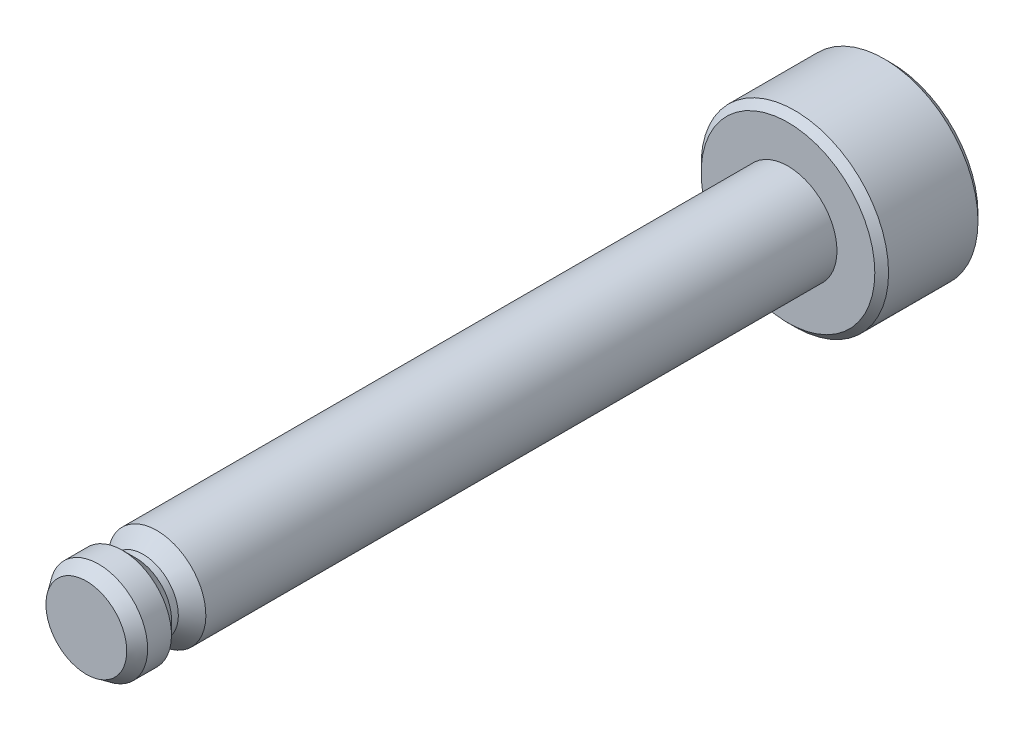
from build123d import *

# Parameters (mm, degrees)
SKETCH2_R      = 1.425
SHAFT_DEPTH    = 20.4
SKETCH5_R      = 2.725
HEAD_DEPTH     = 3
CHAMFER1_SIZE  = 0.25
CHAMFER1_SIZE2 = 0.357037002
DEBURS_SIZE    = 0.2


with BuildPart() as part:
    # Sketch2 → Shaft (new body)
    with BuildSketch(Plane.XY):
        Circle(SKETCH2_R)
    extrude(amount=SHAFT_DEPTH)

    # Sketch5 → Head (add)
    with BuildSketch(Plane.XY):
        Circle(SKETCH5_R)
    extrude(amount=-HEAD_DEPTH)

    # Sketch4 → e-Clip Notch Short (revolve, cut)
    with BuildSketch(Plane(origin=(0, 0, 0), x_dir=(0, 0, -1), z_dir=(1, 0, 0))):
        Polygon((-19.35, 1.425), (-18.35, 1.425), (-18.75, 1.025), (-18.95, 1.025), align=None)
    revolve(axis=Axis((0, 0, 0), (0, 0, 1)), mode=Mode.SUBTRACT)

    # Chamfer1
    chamfer1_edges = [part.edges().sort_by_distance(p)[0] for p in [
        (-1.425, 0, 20.4),
    ]]
    chamfer1_side = [part.faces().sort_by_distance(p)[0] for p in [
        (0, 0, 20.4),
    ]]
    chamfer(chamfer1_edges, length=CHAMFER1_SIZE, length2=CHAMFER1_SIZE2, reference=chamfer1_side[0])

    # Deburs
    deburs_edges = [part.edges().sort_by_distance(p)[0] for p in [
        (-2.725, 0, 0),
        (-2.725, 0, -3),
    ]]
    chamfer(deburs_edges, length=DEBURS_SIZE)


solid = part.part
